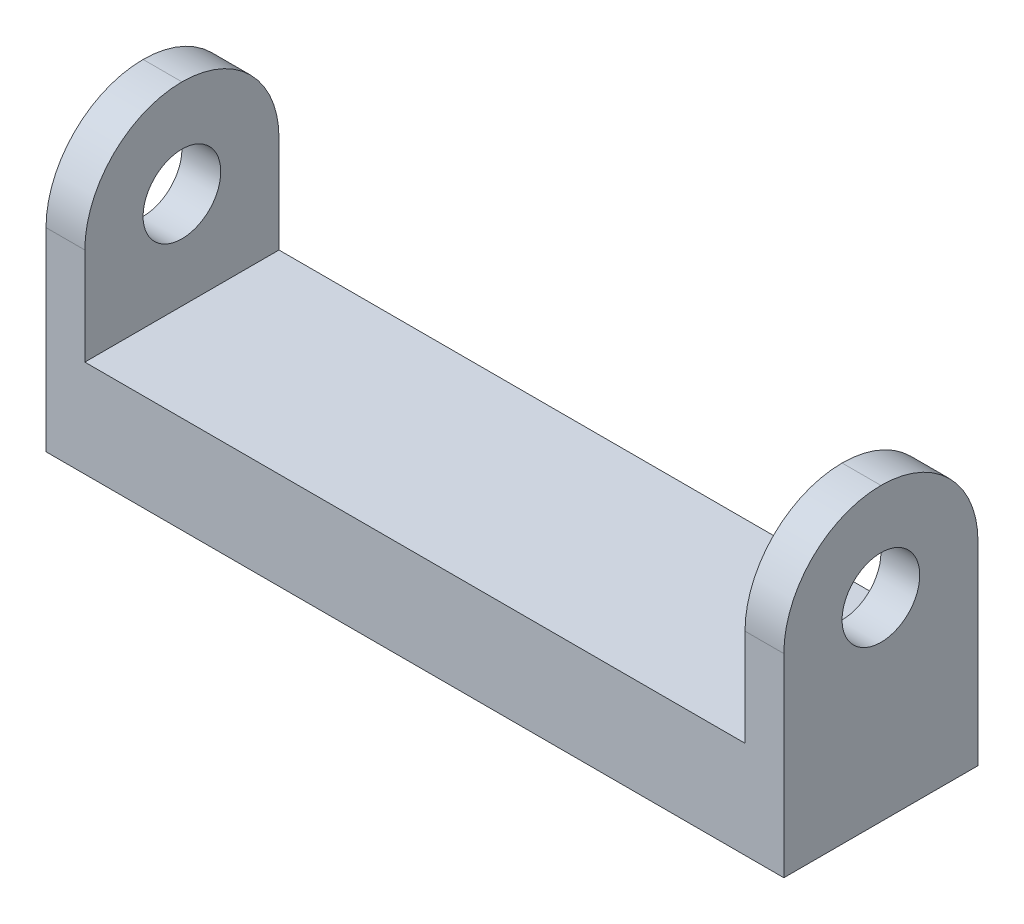
from build123d import *

# Parameters (mm, degrees)
BOSS_EXTRUDE1_DEPTH = 100
FILLET4_R           = 50
SKETCH5_R           = 20
CUT_EXTRUDE1_DEPTH  = 421.594816896


with BuildPart() as part:
    # Sketch2 → Boss-Extrude1 (new body)
    with BuildSketch(Plane.XY):
        Polygon((0, 0), (0, 150), (20, 150), (20, 50), (360, 50), (360, 150), (380, 150), (380, 0), align=None)
    extrude(amount=BOSS_EXTRUDE1_DEPTH)

    # Fillet4
    fillet4_edges = [part.edges().sort_by_distance(p)[0] for p in [
        (10, 150, 0),
        (10, 150, 100),
        (370, 150, 100),
        (370, 150, 0),
    ]]
    fillet(fillet4_edges, radius=FILLET4_R - 0.0001)  # a hair under: the kernel refuses the full size

    # Sketch5 → Cut-Extrude1 (cut, through all)
    with BuildSketch(Plane(origin=(380, 0, 0), x_dir=(0, 0, -1), z_dir=(1, 0, 0))):
        with Locations((-50, 100)):
            Circle(SKETCH5_R)
    extrude(amount=-CUT_EXTRUDE1_DEPTH, mode=Mode.SUBTRACT)


solid = part.part
